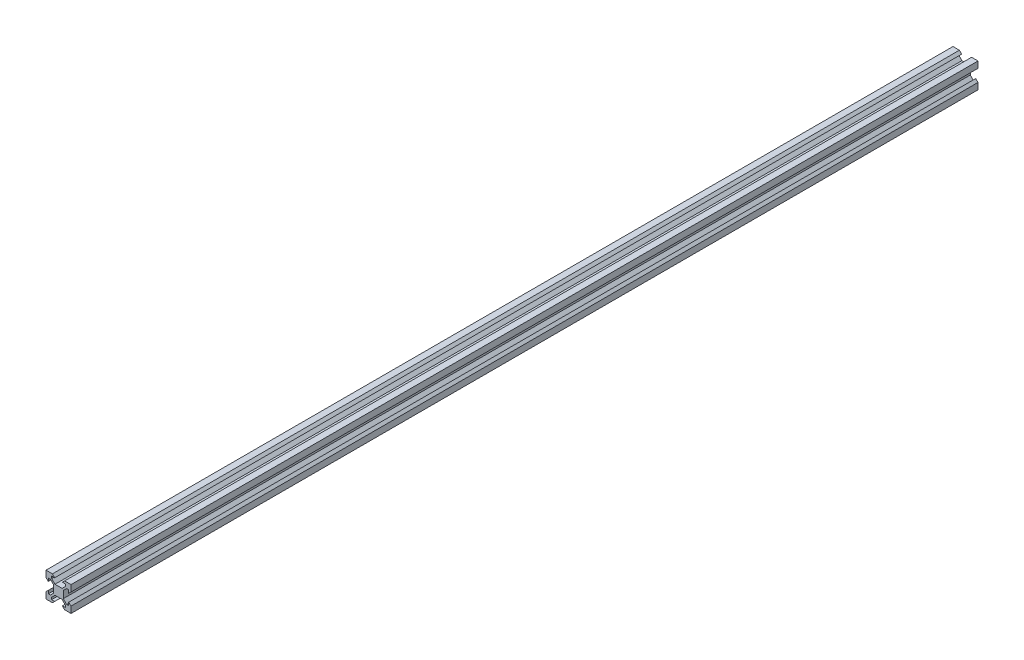
from build123d import *

# Parameters (mm, degrees)
SKETCH1_W           = 20
SKETCH1_H           = 20
BOSS_EXTRUDE1_DEPTH = 725
CUT_EXTRUDE1_DEPTH  = 726.551514367


with BuildPart() as part:
    # Sketch1 → Boss-Extrude1 (new body)
    with BuildSketch(Plane.XY):
        with Locations((10, 10)):
            Rectangle(SKETCH1_W, SKETCH1_H)
    extrude(amount=BOSS_EXTRUDE1_DEPTH)

    # Sketch2 → Cut-Extrude1 (cut, through all)
    with BuildSketch(Plane.XY.offset(725)):
        Polygon((4.5, 18.18), (6.94, 18.18), (5.12, 20), (14.88, 20), (13.06, 18.18), (15.5, 18.18), (15.5, 16.475807358), (12.834192642, 13.81), (7.165807358, 13.81), (4.5, 16.475807358), align=None)
        Polygon((14.88, 0), (13.06, 1.82), (15.5, 1.82), (15.5, 3.524192642), (12.834192642, 6.19), (7.165807358, 6.19), (4.5, 3.524192642), (4.5, 1.82), (6.94, 1.82), (5.12, 0), align=None)
        Polygon((1.82, 4.5), (1.82, 6.94), (0, 5.12), (0, 14.88), (1.82, 13.06), (1.82, 15.5), (3.524192642, 15.5), (6.19, 12.834192642), (6.19, 7.165807358), (3.524192642, 4.5), align=None)
        Polygon((20, 14.88), (18.18, 13.06), (18.18, 15.5), (16.475807358, 15.5), (13.81, 12.834192642), (13.81, 7.165807358), (16.475807358, 4.5), (18.18, 4.5), (18.18, 6.94), (20, 5.12), align=None)
    extrude(amount=-CUT_EXTRUDE1_DEPTH, mode=Mode.SUBTRACT)


solid = part.part
